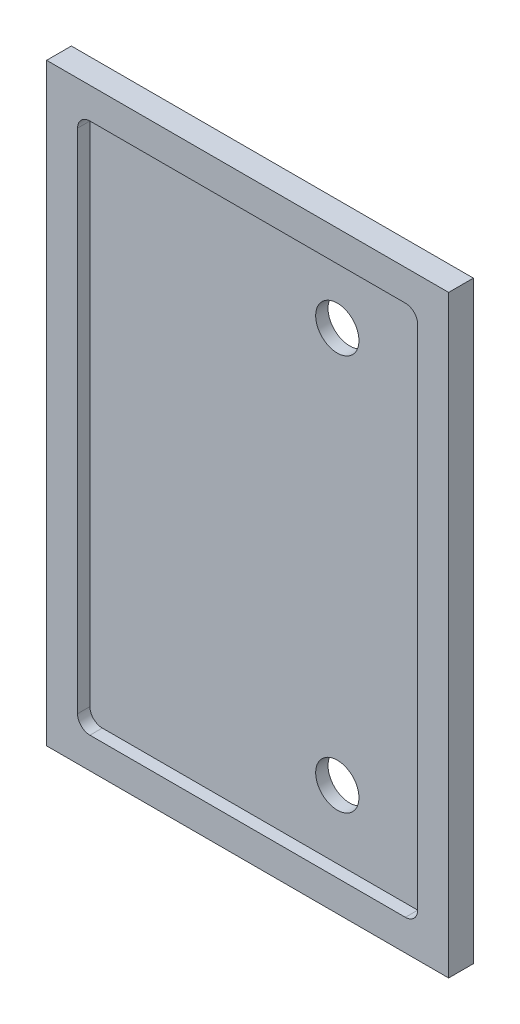
from build123d import *

# Parameters (mm, degrees)
SKETCH1_W           = 206.375
SKETCH1_H           = 304.8
BOSS_EXTRUDE1_DEPTH = 12.7
CUT_EXTRUDE1_DEPTH  = 6.35
SKETCH4_R           = 11.1125
CUT_EXTRUDE3_DEPTH  = 185.484986262


with BuildPart() as part:
    # Sketch1 → Boss-Extrude1 (new body)
    with BuildSketch(Plane.XY):
        Rectangle(SKETCH1_W, SKETCH1_H)
    extrude(amount=BOSS_EXTRUDE1_DEPTH)

    # Sketch2 → Cut-Extrude1 (cut)
    with BuildSketch(Plane.XY.offset(12.7)):
        with BuildLine():
            Line((80.9625, -136.525), (-80.9625, -136.525))
            ThreePointArc((-80.9625, -136.525), (-85.452628061, -134.665128061), (-87.3125, -130.175))
            Line((-87.3125, -130.175), (-87.3125, 130.175))
            ThreePointArc((-87.3125, 130.175), (-85.452628061, 134.665128061), (-80.9625, 136.525))
            Line((-80.9625, 136.525), (80.9625, 136.525))
            ThreePointArc((80.9625, 136.525), (85.452628061, 134.665128061), (87.3125, 130.175))
            Line((87.3125, 130.175), (87.3125, -130.175))
            ThreePointArc((87.3125, -130.175), (85.452628061, -134.665128061), (80.9625, -136.525))
        make_face()
    extrude(amount=-CUT_EXTRUDE1_DEPTH, mode=Mode.SUBTRACT)

    # Sketch4 → Cut-Extrude3 (cut, through all)
    with BuildSketch(Plane(origin=(0, 0, 0), x_dir=(-1, 0, 0), z_dir=(0, 0, -1))):
        with Locations((-39.6875, -101.6)):
            Circle(SKETCH4_R)
        with Locations((-39.6875, 101.6)):
            Circle(SKETCH4_R)
    extrude(amount=-CUT_EXTRUDE3_DEPTH, mode=Mode.SUBTRACT)


solid = part.part
